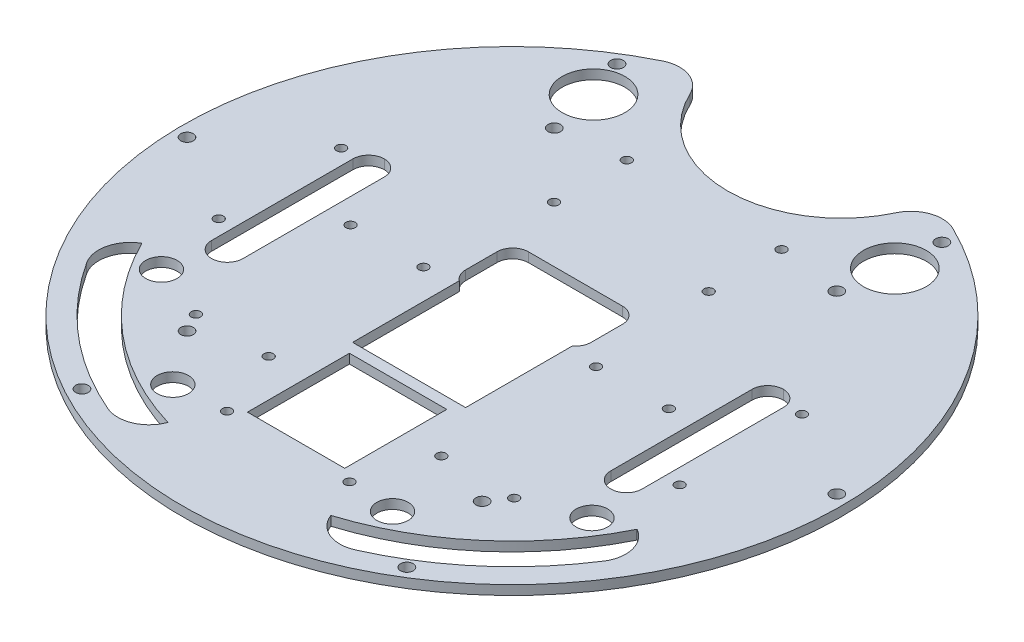
from build123d import *

# Parameters (mm, degrees)
CROQUIS1_R                   = 105
SALIENTE_EXTRUIR1_DEPTH      = 3
CORTAR_EXTRUIR1_START        = -3
CORTAR_EXTRUIR1_DEPTH        = 3
REDONDEO1_R                  = 10
CROQUIS6_R                   = 1.5
CORTAR_EXTRUIR10_DEPTH       = 149.522725677
CROQUIS12_W                  = 31
CROQUIS12_H                  = 32.5
CROQUIS12_W_2                = 36
CROQUIS12_H_2                = 23
CORTAR_EXTRUIR13_DEPTH       = 149.522725677
CROQUIS16_R                  = 1.5
CORTAR_EXTRUIR16_DEPTH       = 149.522725677
CORTAR_EXTRUIR_L_MINA2_DEPTH = 10
CROQUIS18_R                  = 5
CROQUIS18_R_2                = 10
CROQUIS18_W                  = 40
CROQUIS18_H                  = 20
CROQUIS18_W_2                = 10
CROQUIS18_H_2                = 55
CORTAR_EXTRUIR17_DEPTH       = 149.522725677
REDONDEO2_R                  = 5
REDONDEO3_R                  = 10
CROQUIS19_R                  = 2
CORTAR_EXTRUIR18_DEPTH       = 149.522725677
CROQUIS20_R                  = 2
CORTAR_EXTRUIR19_DEPTH       = 149.522725677
CROQUIS21_W                  = 36
CROQUIS21_H                  = 12
CORTAR_EXTRUIR20_DEPTH       = 149.522725677


# Some blends are built 0.0001 mm under size
with BuildPart() as part:
    # Croquis1 → Saliente-Extruir1 (new body)
    with BuildSketch(Plane(origin=(0, 0, 0), x_dir=(1, 0, 0), z_dir=(0, 1, 0))):
        with Locations(Location((0, 0, 0), (0, 0, 270))):
            Circle(CROQUIS1_R)
    extrude(amount=SALIENTE_EXTRUIR1_DEPTH)

    # Croquis2 → Cortar-Extruir1 (cut)
    with BuildSketch(Plane(origin=(0, 3, 0), x_dir=(1, 0, 0), z_dir=(0, 1, 0)).offset(CORTAR_EXTRUIR1_START)):
        with BuildLine():
            ThreePointArc((35.71668902, 98.738635424), (0, 68.738635424), (-35.71668902, 98.738635424))
            ThreePointArc((-35.71668902, 98.738635424), (0, 105), (35.71668902, 98.738635424))
        make_face()
    extrude(amount=CORTAR_EXTRUIR1_DEPTH, mode=Mode.SUBTRACT)

    # Redondeo1
    redondeo1_edges = [part.edges().sort_by_distance(p)[0] for p in [
        (-35.71668902, 1.5, -98.738635424),
        (35.71668902, 1.5, -98.738635424),
    ]]
    fillet(redondeo1_edges, radius=REDONDEO1_R)

    # Croquis6 → Cortar-Extruir10 (cut, through all)
    with BuildSketch(Plane(origin=(0, 3, 0), x_dir=(1, 0, 0), z_dir=(0, 1, 0))):
        with Locations(Location((-50.7, -50, 0), (0, 0, 270))):
            Circle(CROQUIS6_R)
        with Locations(Location((-27.5, -50, 0), (0, 0, 270))):
            Circle(CROQUIS6_R)
        with Locations(Location((-50.7, -0.7, 0), (0, 0, 270))):
            Circle(CROQUIS6_R)
        with Locations(Location((-27.5, -0.7, 0), (0, 0, 270))):
            Circle(CROQUIS6_R)
        with Locations(Location((50.7, -0.7, 0), (0, 0, 270))):
            Circle(CROQUIS6_R)
        with Locations(Location((50.7, -50, 0), (0, 0, 270))):
            Circle(CROQUIS6_R)
        with Locations(Location((27.5, -50, 0), (0, 0, 270))):
            Circle(CROQUIS6_R)
        with Locations(Location((27.5, -0.7, 0), (0, 0, 270))):
            Circle(CROQUIS6_R)
        with Locations(Location((-24.6, 38, 0), (0, 0, 270))):
            Circle(CROQUIS6_R)
        with Locations(Location((-24.6, 61.2, 0), (0, 0, 270))):
            Circle(CROQUIS6_R)
        with Locations(Location((24.7, 38, 0), (0, 0, 270))):
            Circle(CROQUIS6_R)
        with Locations(Location((24.7, 61.2, 0), (0, 0, 270))):
            Circle(CROQUIS6_R)
    extrude(amount=-CORTAR_EXTRUIR10_DEPTH, mode=Mode.SUBTRACT)

    # Croquis12 → Cortar-Extruir13 (cut, through all)
    with BuildSketch(Plane(origin=(0, 3, 0), x_dir=(1, 0, 0), z_dir=(0, 1, 0))):
        with Locations((0, -52.516645147)):
            Rectangle(CROQUIS12_W, CROQUIS12_H)
        with Locations((0, -21.266645147)):
            Rectangle(CROQUIS12_W_2, CROQUIS12_H_2)
    extrude(amount=-CORTAR_EXTRUIR13_DEPTH, mode=Mode.SUBTRACT)

    # Croquis16 → Cortar-Extruir16 (cut, through all)
    with BuildSketch(Plane(origin=(0, 3, 0), x_dir=(1, 0, 0), z_dir=(0, 1, 0))):
        with Locations(Location((-19, -71.766645147, 0), (0, 0, 270))):
            Circle(CROQUIS16_R)
        with Locations(Location((20, -71.766645147, 0), (0, 0, 270))):
            Circle(CROQUIS16_R)
        with Locations(Location((-73.426669568, 19, 0), (0, 0, 270))):
            Circle(CROQUIS16_R)
        with Locations(Location((-73.426669568, -20, 0), (0, 0, 270))):
            Circle(CROQUIS16_R)
        with Locations(Location((73.426669568, 19, 0), (0, 0, 90))):
            Circle(CROQUIS16_R)
        with Locations(Location((73.426669568, -20, 0), (0, 0, 90))):
            Circle(CROQUIS16_R)
    extrude(amount=-CORTAR_EXTRUIR16_DEPTH, mode=Mode.SUBTRACT)

    # Croquis17 → Cortar-Extruir-Lámina2 (cut)
    with BuildSketch(Plane(origin=(0, 3, 0), x_dir=(1, 0, 0), z_dir=(0, 1, 0))):
        with BuildLine():
            ThreePointArc((-78.885993687, -39), (-56.815148476, -67.201479921), (-25.335426507, -84.274053917))
            Line((-25.335426507, -84.274053917), (-28.214452247, -93.850650954))
            ThreePointArc((-28.214452247, -93.850650954), (-63.271415348, -74.838011731), (-87.850311152, -43.431818182))
            Line((-87.850311152, -43.431818182), (-78.885993687, -39))
        make_face()
        with BuildLine():
            ThreePointArc((26.278435016, -83.984783462), (57.19088172, -66.882008404), (78.885993687, -39))
            Line((78.885993687, -39), (87.850311152, -43.431818182))
            ThreePointArc((87.850311152, -43.431818182), (63.689845552, -74.482236631), (29.264620814, -93.528508855))
            Line((29.264620814, -93.528508855), (26.278435016, -83.984783462))
        make_face()
    extrude(amount=-CORTAR_EXTRUIR_L_MINA2_DEPTH, mode=Mode.SUBTRACT)

    # Croquis18 → Cortar-Extruir17 (cut, through all)
    with BuildSketch(Plane(origin=(0, 3, 0), x_dir=(1, 0, 0), z_dir=(0, 1, 0))):
        with Locations(Location((-35, -73.047929471, 0), (0, 0, 270))):
            Circle(CROQUIS18_R)
        with Locations(Location((-68.583851236, -43.095885531, 0), (0, 0, 270))):
            Circle(CROQUIS18_R)
        with Locations(Location((35, -73.047929471, 0), (0, 0, 90))):
            Circle(CROQUIS18_R)
        with Locations(Location((68.583851236, -43.095885531, 0), (0, 0, 90))):
            Circle(CROQUIS18_R)
        with Locations(Location((-48, 74, 0), (0, 0, 270))):
            Circle(CROQUIS18_R_2)
        with Locations(Location((48, 74, 0), (0, 0, 270))):
            Circle(CROQUIS18_R_2)
        with Locations((0, 10.233354853)):
            Rectangle(CROQUIS18_W, CROQUIS18_H)
        with Locations((-63.583851236, -4.595885531)):
            Rectangle(CROQUIS18_W_2, CROQUIS18_H_2)
        with Locations((63.583851236, -4.595885531)):
            Rectangle(CROQUIS18_W_2, CROQUIS18_H_2)
    extrude(amount=-CORTAR_EXTRUIR17_DEPTH, mode=Mode.SUBTRACT)

    # Redondeo2
    redondeo2_edges = [part.edges().sort_by_distance(p)[0] for p in [
        (20, 1.5, -0.233354853),
        (20, 1.5, -20.233354853),
        (-20, 1.5, -0.233354853),
        (-20, 1.5, -20.233354853),
        (68.583851236, 1.5, 32.095885531),
        (58.583851236, 1.5, 32.095885531),
        (68.583851236, 1.5, -22.904114469),
        (58.583851236, 1.5, -22.904114469),
        (-58.583851236, 1.5, 32.095885531),
        (-68.583851236, 1.5, 32.095885531),
        (-58.583851236, 1.5, -22.904114469),
        (-68.583851236, 1.5, -22.904114469),
    ]]
    fillet(redondeo2_edges, radius=REDONDEO2_R - 0.0001)  # a hair under: the kernel refuses the full size

    # Redondeo3
    # the kernel refuses this fillet: 10 mm, written as the material it adds along each edge
    with BuildSketch(Plane(origin=(87.850311152, 3, 43.431818182), x_dir=(-0.49339949863850674, 0, 0.8698028137131256), z_dir=(0, -1, 0)), Plane(origin=(-28.214452247, 3, 93.850650954), x_dir=(-0.9397545440307068, 0, -0.3418499626643806), z_dir=(0, -1, 0))) as redondeo3_piece_1:
        with BuildLine():
            CenterArc((10.568181818, 9.983845423), REDONDEO3_R, 180, 93.257196161)
            Line((0.568181818, 9.983845423), (0.368181818, 9.983845423))
            ThreePointArc((0.368181818, 9.983845423), (0.084414001, 5.003286348), (-0.199676908, 0.011363636))
            Line((-0.199676908, 0.011363636), (-0.011363636, -0.199676908))
            ThreePointArc((-0.011363636, -0.199676908), (5.568181818, -0.358314859), (11.147727273, -0.199676908))
            Line((11.147727273, -0.199676908), (11.136363636, 0))
        make_face()
    extrude(amount=3)
    with BuildSketch(Plane(origin=(29.264620814, 3, 93.528508855), x_dir=(0.9358638260686325, 0, -0.35236188649764677), z_dir=(0, -1, 0)), Plane(origin=(-87.850311152, 3, 43.431818182), x_dir=(0.4933994986385089, 0, 0.8698028137131243), z_dir=(0, -1, 0))) as redondeo3_piece_2:
        with BuildLine():
            CenterArc((10.568181818, -9.983845423), REDONDEO3_R, 86.742803839, 93.257196161)
            Line((0.568181818, -9.983845423), (0.368181818, -9.983845423))
            ThreePointArc((0.368181818, -9.983845423), (0.084414001, -5.003286348), (-0.199676908, -0.011363636))
            Line((-0.199676908, -0.011363636), (-0.011363636, 0.199676908))
            ThreePointArc((-0.011363636, 0.199676908), (5.568181818, 0.358314859), (11.147727273, 0.199676908))
            Line((11.147727273, 0.199676908), (11.136363636, 0))
        make_face()
    extrude(amount=3)

    # Croquis19 → Cortar-Extruir18 (cut, through all)
    with BuildSketch(Plane(origin=(0, 3, 0), x_dir=(1, 0, 0), z_dir=(0, 1, 0))):
        with Locations(Location((-100.967732044, -2.552858359, 0), (0, 0, 270))):
            Circle(CROQUIS19_R)
        with Locations(Location((-52.694706213, 86.164191734, 0), (0, 0, 270))):
            Circle(CROQUIS19_R)
        with Locations(Location((48.273025831, 88.717050092, 0), (0, 0, 270))):
            Circle(CROQUIS19_R)
        with Locations(Location((100.967732044, 2.552858359, 0), (0, 0, 270))):
            Circle(CROQUIS19_R)
        with Locations(Location((52.694706213, -86.164191734, 0), (0, 0, 270))):
            Circle(CROQUIS19_R)
        with Locations(Location((-48.273025831, -88.717050092, 0), (0, 0, 270))):
            Circle(CROQUIS19_R)
    extrude(amount=-CORTAR_EXTRUIR18_DEPTH, mode=Mode.SUBTRACT)

    # Croquis20 → Cortar-Extruir19 (cut, through all)
    with BuildSketch(Plane(origin=(0, 3, 0), x_dir=(1, 0, 0), z_dir=(0, 1, 0))):
        with Locations(Location((-47.5, -56, 0), (0, 0, 270))):
            Circle(CROQUIS20_R)
        with Locations(Location((46.5, -56, 0), (0, 0, 90))):
            Circle(CROQUIS20_R)
        with Locations(Location((45, 58.5, 0), (0, 0, 270))):
            Circle(CROQUIS20_R)
        with Locations(Location((-45, 58.5, 0), (0, 0, 270))):
            Circle(CROQUIS20_R)
    extrude(amount=-CORTAR_EXTRUIR19_DEPTH, mode=Mode.SUBTRACT)

    # Croquis21 → Cortar-Extruir20 (cut, through all)
    with BuildSketch(Plane(origin=(0, 3, 0), x_dir=(1, 0, 0), z_dir=(0, 1, 0))):
        with Locations((0, -3.766645147)):
            Rectangle(CROQUIS21_W, CROQUIS21_H)
    extrude(amount=-CORTAR_EXTRUIR20_DEPTH, mode=Mode.SUBTRACT)


solid = part.part
